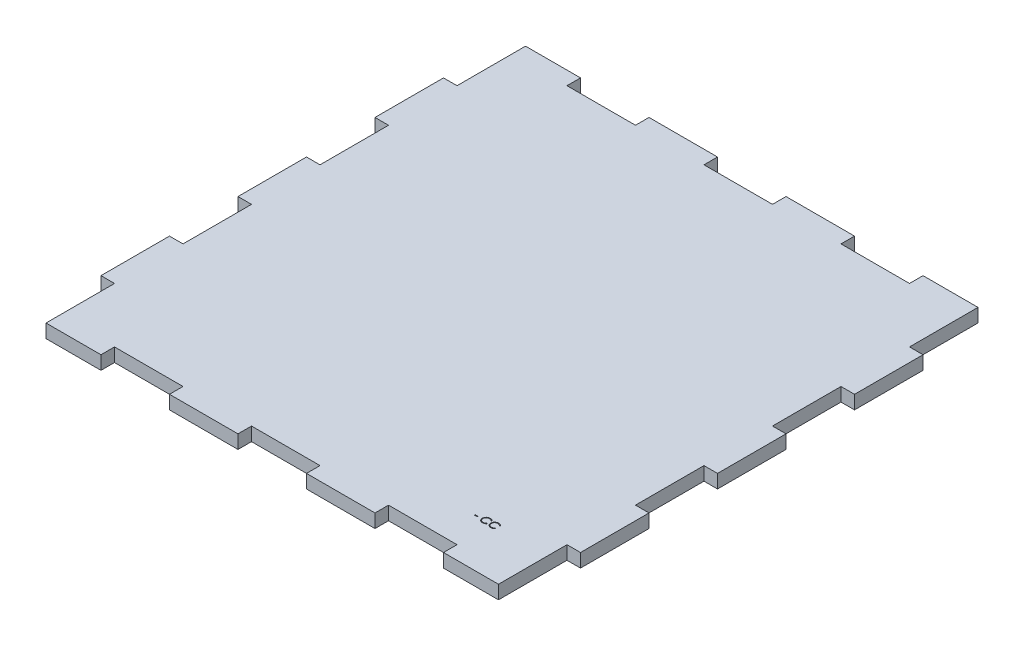
from build123d import *

# Parameters (mm, degrees)
BOSS_EXTRUDE1_DEPTH = 6.35
SKETCH2_W           = 1.346153847
SKETCH2_H           = 0.358974359
CUT_EXTRUDE1_DEPTH  = 319.261405923


with BuildPart() as part:
    # Sketch1 → Boss-Extrude1 (new body)
    with BuildSketch(Plane(origin=(0, 0, 0), x_dir=(1, 0, 0), z_dir=(0, 1, 0))):
        Polygon((6.35, 0), (32.142857143, 0), (32.142857143, 6.35), (64.285714286, 6.35), (64.285714286, 0), (96.428571429, 0), (96.428571429, 6.35), (128.571428571, 6.35), (128.571428571, 0), (160.714285714, 0), (160.714285714, 6.35), (192.857142857, 6.35), (192.857142857, 0), (218.65, 0), (218.65, 32.142857143), (225, 32.142857143), (225, 64.285714286), (218.65, 64.285714286), (218.65, 96.428571429), (225, 96.428571429), (225, 128.571428571), (218.65, 128.571428571), (218.65, 160.714285714), (225, 160.714285714), (225, 192.857142857), (218.65, 192.857142857), (218.65, 225), (192.857142857, 225), (192.857142857, 218.65), (160.714285714, 218.65), (160.714285714, 225), (128.571428571, 225), (128.571428571, 218.65), (96.428571429, 218.65), (96.428571429, 225), (64.285714286, 225), (64.285714286, 218.65), (32.142857143, 218.65), (32.142857143, 225), (6.35, 225), (6.35, 192.857142857), (0, 192.857142857), (0, 160.714285714), (6.35, 160.714285714), (6.35, 128.571428571), (0, 128.571428571), (0, 96.428571429), (6.35, 96.428571429), (6.35, 64.285714286), (0, 64.285714286), (0, 32.142857143), (6.35, 32.142857143), align=None)
    extrude(amount=BOSS_EXTRUDE1_DEPTH)

    # Sketch2 → Cut-Extrude1 (cut, through all)
    with BuildSketch(Plane(origin=(0, 6.35, 0), x_dir=(1, 0, 0), z_dir=(0, 1, 0))):
        with Locations((185.602351007, 22.631378238)):
            Rectangle(SKETCH2_W, SKETCH2_H)
        with BuildLine():
            Line((191.43568434, 24.142996827), (191.160844596, 23.932660288))
            add(Edge.make_bspline(
                [(191.160844596, 23.932660288), (191.141238708, 23.956026258), (191.102291261, 24.002443174), (191.039632058, 24.067622718), (190.974330416, 24.12868798), (190.906411294, 24.185929859), (190.834652175, 24.237346625), (190.760791376, 24.285617728), (190.683593331, 24.328885466), (190.576841596, 24.381348452), (190.437193748, 24.436094607), (190.261398909, 24.481997838), (190.077887811, 24.511219014), (189.952690211, 24.514383856), (189.88900966, 24.515993622)],
                knots=[0, 0, 0, 0, 0.757959112, 1.505699292, 2.245454638, 2.979532153, 3.711538275, 4.438200793, 5.171680507, 5.909471876, 7.393775596, 8.890124382, 10.418191784, 12, 12, 12, 12], degree=3))
            add(Edge.make_bspline(
                [(189.88900966, 24.515993622), (189.853926361, 24.515589659), (189.784085368, 24.514785483), (189.680436895, 24.504176358), (189.578723844, 24.489265148), (189.479012378, 24.467139825), (189.381429419, 24.439167206), (189.285337017, 24.405741792), (189.192126417, 24.364386952), (189.100508179, 24.318678692), (189.012728968, 24.267051247), (188.92967392, 24.210737895), (188.851645952, 24.150368799), (188.77858334, 24.085717693), (188.710411392, 24.017075732), (188.647624081, 23.943711391), (188.590438671, 23.865859217), (188.537721646, 23.784545809), (188.490508912, 23.700008018), (188.450979033, 23.611932947), (188.415973911, 23.521828844), (188.388274668, 23.428677683), (188.366350151, 23.333134918), (188.351222488, 23.23494413), (188.340734017, 23.13431045), (188.33993384, 23.066101137), (188.339530494, 23.031718782)],
                knots=[0, 0, 0, 0, 1.054917814, 2.100044995, 3.131103042, 4.146048494, 5.169673617, 6.183595914, 7.203665975, 8.234915748, 9.262203917, 10.264457458, 11.251630812, 12.227803204, 13.197192746, 14.159520551, 15.12972552, 16.100847026, 17.073214652, 18.039054194, 19.002613845, 19.979014051, 20.95965708, 21.949030935, 22.966165397, 24, 24, 24, 24], degree=3))
            add(Edge.make_bspline(
                [(188.339530494, 23.031718782), (188.340792313, 22.979987462), (188.343269727, 22.878419877), (188.365318061, 22.729649267), (188.398823152, 22.587128593), (188.449038729, 22.451748751), (188.51095778, 22.321840392), (188.589198391, 22.199601539), (188.679814929, 22.083184975), (188.784089348, 21.975342027), (188.898495164, 21.876828302), (189.021243076, 21.79007772), (189.152027363, 21.717762838), (189.289403994, 21.657586891), (189.434430108, 21.611330163), (189.58684491, 21.57876604), (189.746316905, 21.557523859), (189.855286305, 21.555490171), (189.910744436, 21.55445516)],
                knots=[0, 0, 0, 0, 1.029171465, 2.020641659, 2.987623507, 3.938342917, 4.889210282, 5.84687017, 6.821220943, 7.821438502, 8.827599549, 9.822697543, 10.807740252, 11.797342354, 12.80366471, 13.83203677, 14.896651826, 16, 16, 16, 16], degree=3))
            add(Edge.make_bspline(
                [(189.910744436, 21.55445516), (189.971847125, 21.55614394), (190.092111834, 21.559467862), (190.26847986, 21.587627112), (190.437315626, 21.633285029), (190.598628212, 21.697182952), (190.751962859, 21.78024824), (190.897559519, 21.880946117), (191.035541089, 22.00023445), (191.118512372, 22.091317578), (191.160844596, 22.137788493)],
                knots=[0, 0, 0, 0, 1.028121516, 2.023589091, 2.998037872, 3.967518031, 4.937445131, 5.927275754, 6.942489185, 8, 8, 8, 8], degree=3))
            Line((191.160844596, 22.137788493), (191.43568434, 21.92955532))
            add(Edge.make_bspline(
                [(191.43568434, 21.92955532), (191.41356623, 21.901016868), (191.369435955, 21.844076662), (191.297977938, 21.763804952), (191.22270064, 21.688300917), (191.14304493, 21.618173296), (191.059927139, 21.55201883), (190.971854826, 21.491716999), (190.879985794, 21.436426115), (190.784631315, 21.38579919), (190.685892702, 21.340881943), (190.583888267, 21.302428175), (190.479057692, 21.269303286), (190.371396183, 21.242051349), (190.260680426, 21.220780265), (190.147309952, 21.20656059), (190.031040077, 21.196818676), (189.952598656, 21.19593076), (189.912847801, 21.195480801)],
                knots=[0, 0, 0, 0, 0.986787822, 1.968848986, 2.935600012, 3.899624008, 4.868462664, 5.837806735, 6.815139263, 7.798259679, 8.787526145, 9.778297419, 10.776456485, 11.791383307, 12.812564526, 13.85620153, 14.913611965, 16, 16, 16, 16], degree=3))
            add(Edge.make_bspline(
                [(189.912847801, 21.195480801), (189.875204134, 21.195742794), (189.800768444, 21.196260852), (189.690869693, 21.204653019), (189.583880112, 21.216102756), (189.480105486, 21.233342887), (189.378979511, 21.253687227), (189.281418926, 21.280958484), (189.186463716, 21.31150765), (189.094495375, 21.347412637), (189.005435675, 21.387928819), (188.919571864, 21.433720378), (188.836943432, 21.484402243), (188.756738011, 21.538857253), (188.680140427, 21.598834555), (188.606486902, 21.66350119), (188.535364426, 21.732639201), (188.491361741, 21.782494054), (188.469238026, 21.807560128)],
                knots=[0, 0, 0, 0, 1.114604814, 2.203992996, 3.262667896, 4.300477797, 5.318619304, 6.316056647, 7.298880507, 8.271930387, 9.238335007, 10.195173496, 11.151986948, 12.108099108, 13.064862484, 14.031167946, 15.010108607, 16, 16, 16, 16], degree=3))
            add(Edge.make_bspline(
                [(188.469238026, 21.807560128), (188.433802382, 21.851101317), (188.363358905, 21.937658027), (188.273233222, 22.077944009), (188.196085667, 22.224412218), (188.133709746, 22.377832146), (188.084947013, 22.537859534), (188.051165818, 22.704575048), (188.029214213, 22.87782299), (188.026703924, 22.995659779), (188.02542793, 23.055556923)],
                knots=[0, 0, 0, 0, 0.994628077, 1.977248131, 2.950237994, 3.925870899, 4.908910175, 5.911660606, 6.938484602, 8, 8, 8, 8], degree=3))
            add(Edge.make_bspline(
                [(188.02542793, 23.055556923), (188.026983123, 23.118512377), (188.030042869, 23.242373301), (188.056038665, 23.424147254), (188.097857461, 23.598298653), (188.15725435, 23.764502398), (188.232559701, 23.923632678), (188.325586315, 24.074473883), (188.435253457, 24.217990683), (188.560701025, 24.352005434), (188.69826836, 24.474544786), (188.845587174, 24.58235099), (189.002369121, 24.672068506), (189.166886972, 24.747064669), (189.340372654, 24.804709132), (189.522456023, 24.845062318), (189.712794938, 24.870179435), (189.842657364, 24.873354643), (189.908641071, 24.874967981)],
                knots=[0, 0, 0, 0, 1.032925535, 2.032216505, 3.007276963, 3.968222605, 4.92396291, 5.891752235, 6.871517503, 7.883894988, 8.900124299, 9.891468569, 10.874487609, 11.85992873, 12.854644235, 13.869047385, 14.917252991, 16, 16, 16, 16], degree=3))
            add(Edge.make_bspline(
                [(189.908641071, 24.874967981), (189.948855542, 24.874485842), (190.02845604, 24.873531498), (190.146208692, 24.864225356), (190.260851019, 24.84871175), (190.372462001, 24.82759568), (190.481584617, 24.801388359), (190.587384858, 24.767248061), (190.690483545, 24.728211529), (190.790230453, 24.683253063), (190.886147003, 24.632786322), (190.978203322, 24.577370698), (191.065668181, 24.517074893), (191.149157029, 24.452411717), (191.22727324, 24.382013158), (191.302234719, 24.307815562), (191.371495797, 24.227681738), (191.414248992, 24.171276804), (191.43568434, 24.142996827)],
                knots=[0, 0, 0, 0, 1.096760587, 2.17092713, 3.219439832, 4.250915756, 5.268269357, 6.278326846, 7.281116186, 8.274029601, 9.260640565, 10.235837813, 11.203064059, 12.156899882, 13.114053108, 14.069676657, 15.032185724, 16, 16, 16, 16], degree=3))
        make_face()
        with BuildLine():
            Line((195.384402288, 24.142996827), (195.109562545, 23.932660288))
            add(Edge.make_bspline(
                [(195.109562545, 23.932660288), (195.089956657, 23.956026258), (195.05100921, 24.002443174), (194.988350007, 24.067622718), (194.923048364, 24.12868798), (194.855129243, 24.185929859), (194.783370124, 24.237346625), (194.709509325, 24.285617728), (194.63231128, 24.328885466), (194.525559545, 24.381348452), (194.385911697, 24.436094607), (194.210116858, 24.481997838), (194.026605759, 24.511219014), (193.90140816, 24.514383856), (193.837727609, 24.515993622)],
                knots=[0, 0, 0, 0, 0.757959112, 1.505699292, 2.245454638, 2.979532153, 3.711538275, 4.438200793, 5.171680507, 5.909471876, 7.393775596, 8.890124382, 10.418191784, 12, 12, 12, 12], degree=3))
            add(Edge.make_bspline(
                [(193.837727609, 24.515993622), (193.80264431, 24.515589659), (193.732803317, 24.514785483), (193.629154844, 24.504176358), (193.527441792, 24.489265148), (193.427730326, 24.467139825), (193.330147368, 24.439167206), (193.234054966, 24.405741792), (193.140844366, 24.364386952), (193.049226128, 24.318678692), (192.961446917, 24.267051247), (192.878391869, 24.210737895), (192.800363901, 24.150368799), (192.727301289, 24.085717693), (192.65912934, 24.017075732), (192.59634203, 23.943711391), (192.539156619, 23.865859217), (192.486439594, 23.784545809), (192.439226861, 23.700008018), (192.399696982, 23.611932947), (192.364691859, 23.521828844), (192.336992617, 23.428677683), (192.3150681, 23.333134918), (192.299940437, 23.23494413), (192.289451965, 23.13431045), (192.288651789, 23.066101137), (192.288248442, 23.031718782)],
                knots=[0, 0, 0, 0, 1.054917814, 2.100044995, 3.131103042, 4.146048494, 5.169673617, 6.183595914, 7.203665975, 8.234915748, 9.262203917, 10.264457458, 11.251630812, 12.227803204, 13.197192746, 14.159520551, 15.12972552, 16.100847026, 17.073214652, 18.039054194, 19.002613845, 19.979014051, 20.95965708, 21.949030935, 22.966165397, 24, 24, 24, 24], degree=3))
            add(Edge.make_bspline(
                [(192.288248442, 23.031718782), (192.289510261, 22.979987462), (192.291987676, 22.878419877), (192.31403601, 22.729649267), (192.347541101, 22.587128593), (192.397756678, 22.451748751), (192.459675729, 22.321840392), (192.53791634, 22.199601539), (192.628532877, 22.083184975), (192.732807297, 21.975342027), (192.847213113, 21.876828302), (192.969961024, 21.79007772), (193.100745312, 21.717762838), (193.238121942, 21.657586891), (193.383148056, 21.611330163), (193.535562859, 21.57876604), (193.695034854, 21.557523859), (193.804004254, 21.555490171), (193.859462385, 21.55445516)],
                knots=[0, 0, 0, 0, 1.029171465, 2.020641659, 2.987623507, 3.938342917, 4.889210282, 5.84687017, 6.821220943, 7.821438502, 8.827599549, 9.822697543, 10.807740252, 11.797342354, 12.80366471, 13.83203677, 14.896651826, 16, 16, 16, 16], degree=3))
            add(Edge.make_bspline(
                [(193.859462385, 21.55445516), (193.920565074, 21.55614394), (194.040829783, 21.559467862), (194.217197809, 21.587627112), (194.386033575, 21.633285029), (194.547346161, 21.697182952), (194.700680807, 21.78024824), (194.846277468, 21.880946117), (194.984259038, 22.00023445), (195.06723032, 22.091317578), (195.109562545, 22.137788493)],
                knots=[0, 0, 0, 0, 1.028121516, 2.023589091, 2.998037872, 3.967518031, 4.937445131, 5.927275754, 6.942489185, 8, 8, 8, 8], degree=3))
            Line((195.109562545, 22.137788493), (195.384402288, 21.92955532))
            add(Edge.make_bspline(
                [(195.384402288, 21.92955532), (195.362284179, 21.901016868), (195.318153903, 21.844076662), (195.246695886, 21.763804952), (195.171418589, 21.688300917), (195.091762879, 21.618173296), (195.008645087, 21.55201883), (194.920572775, 21.491716999), (194.828703743, 21.436426115), (194.733349264, 21.38579919), (194.634610651, 21.340881943), (194.532606216, 21.302428175), (194.42777564, 21.269303286), (194.320114132, 21.242051349), (194.209398375, 21.220780265), (194.096027901, 21.20656059), (193.979758026, 21.196818676), (193.901316605, 21.19593076), (193.86156575, 21.195480801)],
                knots=[0, 0, 0, 0, 0.986787822, 1.968848986, 2.935600012, 3.899624008, 4.868462664, 5.837806735, 6.815139263, 7.798259679, 8.787526145, 9.778297419, 10.776456485, 11.791383307, 12.812564526, 13.85620153, 14.913611965, 16, 16, 16, 16], degree=3))
            add(Edge.make_bspline(
                [(193.86156575, 21.195480801), (193.823922083, 21.195742794), (193.749486393, 21.196260852), (193.639587641, 21.204653019), (193.53259806, 21.216102756), (193.428823435, 21.233342887), (193.32769746, 21.253687227), (193.230136875, 21.280958484), (193.135181665, 21.31150765), (193.043213324, 21.347412637), (192.954153624, 21.387928819), (192.868289813, 21.433720378), (192.78566138, 21.484402243), (192.70545596, 21.538857253), (192.628858376, 21.598834555), (192.555204851, 21.66350119), (192.484082374, 21.732639201), (192.440079689, 21.782494054), (192.417955974, 21.807560128)],
                knots=[0, 0, 0, 0, 1.114604814, 2.203992996, 3.262667896, 4.300477797, 5.318619304, 6.316056647, 7.298880507, 8.271930387, 9.238335007, 10.195173496, 11.151986948, 12.108099108, 13.064862484, 14.031167946, 15.010108607, 16, 16, 16, 16], degree=3))
            add(Edge.make_bspline(
                [(192.417955974, 21.807560128), (192.382520331, 21.851101317), (192.312076854, 21.937658027), (192.221951171, 22.077944009), (192.144803615, 22.224412218), (192.082427695, 22.377832146), (192.033664961, 22.537859534), (191.999883766, 22.704575048), (191.977932162, 22.87782299), (191.975421873, 22.995659779), (191.974145878, 23.055556923)],
                knots=[0, 0, 0, 0, 0.994628077, 1.977248131, 2.950237994, 3.925870899, 4.908910175, 5.911660606, 6.938484602, 8, 8, 8, 8], degree=3))
            add(Edge.make_bspline(
                [(191.974145878, 23.055556923), (191.975701072, 23.118512377), (191.978760818, 23.242373301), (192.004756613, 23.424147254), (192.04657541, 23.598298653), (192.105972298, 23.764502398), (192.18127765, 23.923632678), (192.274304263, 24.074473883), (192.383971406, 24.217990683), (192.509418973, 24.352005434), (192.646986309, 24.474544786), (192.794305123, 24.58235099), (192.951087069, 24.672068506), (193.115604921, 24.747064669), (193.289090603, 24.804709132), (193.471173972, 24.845062318), (193.661512887, 24.870179435), (193.791375312, 24.873354643), (193.857359019, 24.874967981)],
                knots=[0, 0, 0, 0, 1.032925535, 2.032216505, 3.007276963, 3.968222605, 4.92396291, 5.891752235, 6.871517503, 7.883894988, 8.900124299, 9.891468569, 10.874487609, 11.85992873, 12.854644235, 13.869047385, 14.917252991, 16, 16, 16, 16], degree=3))
            add(Edge.make_bspline(
                [(193.857359019, 24.874967981), (193.897573491, 24.874485842), (193.977173989, 24.873531498), (194.094926641, 24.864225356), (194.209568968, 24.84871175), (194.32117995, 24.82759568), (194.430302566, 24.801388359), (194.536102807, 24.767248061), (194.639201494, 24.728211529), (194.738948402, 24.683253063), (194.834864952, 24.632786322), (194.926921271, 24.577370698), (195.014386129, 24.517074893), (195.097874978, 24.452411717), (195.175991189, 24.382013158), (195.250952667, 24.307815562), (195.320213746, 24.227681738), (195.362966941, 24.171276804), (195.384402288, 24.142996827)],
                knots=[0, 0, 0, 0, 1.096760587, 2.17092713, 3.219439832, 4.250915756, 5.268269357, 6.278326846, 7.281116186, 8.274029601, 9.260640565, 10.235837813, 11.203064059, 12.156899882, 13.114053108, 14.069676657, 15.032185724, 16, 16, 16, 16], degree=3))
        make_face()
    extrude(amount=-CUT_EXTRUDE1_DEPTH, mode=Mode.SUBTRACT)


solid = part.part
